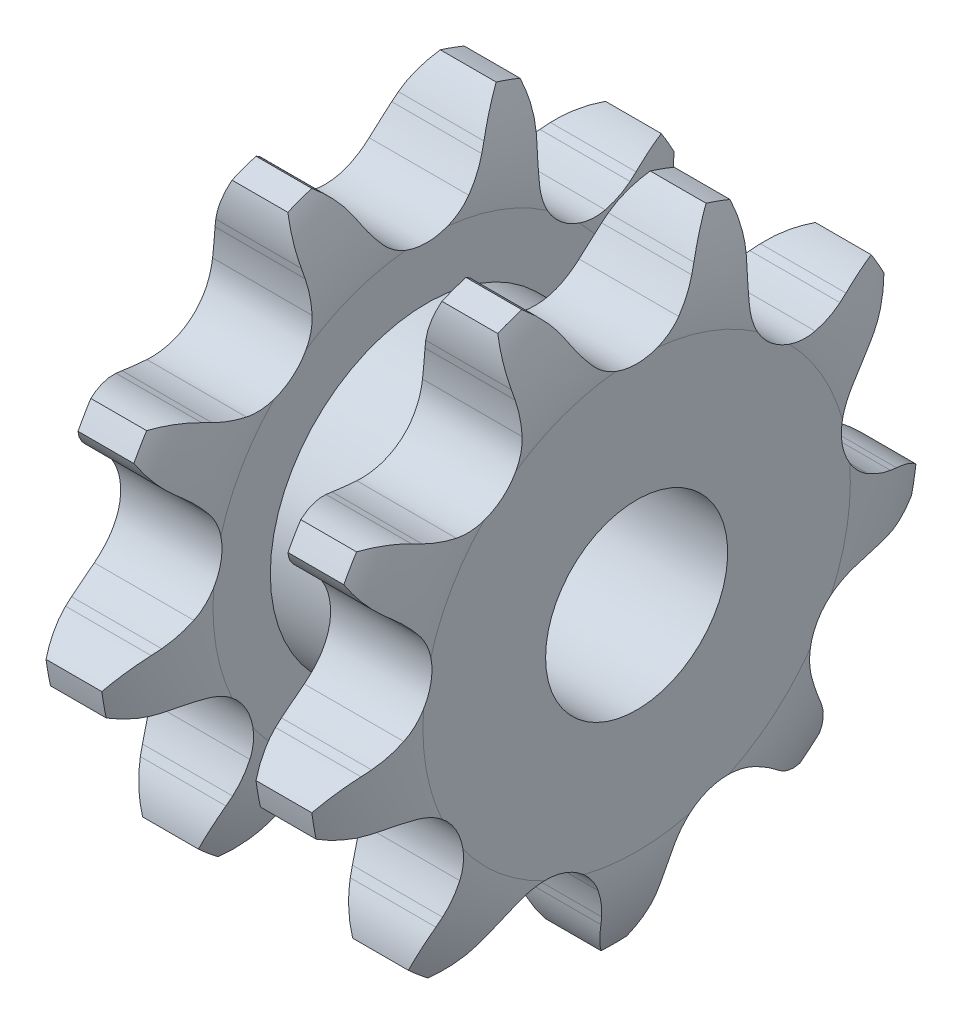
from build123d import *

# Parameters (mm, degrees)
TOOTHCUT_DEPTH  = 75.162749314
TEETHCUTS_COUNT = 9
TEETHCUTS_ANGLE = 320
BORSKE_R        = 12.7
BORE_DEPTH      = 50.8000508


with BuildPart() as part:
    # BasProSke → Base-Revolve (revolve)
    with BuildSketch(Plane(origin=(0, 0, 0), x_dir=(1, 0, 0), z_dir=(0, 1, 0))):
        with BuildLine():
            Line((0, 0), (0, 29.81296327))
            ThreePointArc((0, 29.81296327), (0.805779277, 36.358393451), (3.175, 42.51296327))
            Line((3.175, 42.51296327), (40.2463, 42.51296327))
            ThreePointArc((40.2463, 42.51296327), (42.615520723, 36.358393451), (43.4213, 29.81296327))
            Line((43.4213, 29.81296327), (43.4213, 0))
            Line((43.4213, 0), (0, 0))
        make_face()
    revolve(axis=Axis((-10, 0, 0), (1, 0, 0)))

    # GrvSke → Groove (revolve, cut)
    with BuildSketch(Plane(origin=(0, 0, 0), x_dir=(1, 0, 0), z_dir=(0, 1, 0))):
        with BuildLine():
            Line((14.1351, 29.81296327), (14.1351, 21.81196327))
            Line((14.1351, 21.81196327), (29.2862, 21.81196327))
            Line((29.2862, 21.81196327), (29.2862, 29.81296327))
            ThreePointArc((29.2862, 29.81296327), (30.091979277, 36.358393451), (32.4612, 42.51296327))
            Line((32.4612, 42.51296327), (10.9601, 42.51296327))
            ThreePointArc((10.9601, 42.51296327), (13.329320723, 36.358393451), (14.1351, 29.81296327))
        make_face()
    revolve(axis=Axis((0, 0, 0), (1, 0, 0)), mode=Mode.SUBTRACT)

    # TooCutSke → ToothCut (cut, through all)
    with BuildSketch(Plane(origin=(0, 0, 0), x_dir=(0, 0, -1), z_dir=(1, 0, 0))):
        with BuildLine():
            Line((8.47279918, 35.252389283), (9.083041546, 36.314109686))
            ThreePointArc((9.083041546, 36.314109686), (14.067176265, 41.312763793), (20.8846685, 43.143048309))
            ThreePointArc((20.8846685, 43.143048309), (0, 47.93216035), (-20.8846685, 43.143048309))
            ThreePointArc((-20.8846685, 43.143048309), (-14.067176265, 41.312763793), (-9.083041546, 36.314109686))
            Line((-9.083041546, 36.314109686), (-8.47279918, 35.252389283))
            ThreePointArc((-8.47279918, 35.252389283), (-7.318900332, 33.464174361), (-5.987620716, 31.803785931))
            ThreePointArc((-5.987620716, 31.803785931), (0, 29.117028423), (5.987620716, 31.803785931))
            ThreePointArc((5.987620716, 31.803785931), (7.318900332, 33.464174361), (8.47279918, 35.252389283))
        make_face()
    toothcut = extrude(amount=TOOTHCUT_DEPTH, mode=Mode.SUBTRACT)

    # TeethCuts: ToothCut ×9 about axis
    teethcuts_axis = Axis((-10, 0, 0), (1, 0, 0))
    for i in range(1, TEETHCUTS_COUNT):
        add(toothcut.rotate(teethcuts_axis, i * TEETHCUTS_ANGLE / (TEETHCUTS_COUNT - 1)), mode=Mode.SUBTRACT)

    # BorSke → Bore (cut, symmetric)
    with BuildSketch(Plane(origin=(0, 0, 0), x_dir=(0, 0, -1), z_dir=(1, 0, 0))):
        Circle(BORSKE_R)
    extrude(amount=BORE_DEPTH, both=True, mode=Mode.SUBTRACT)


solid = part.part
